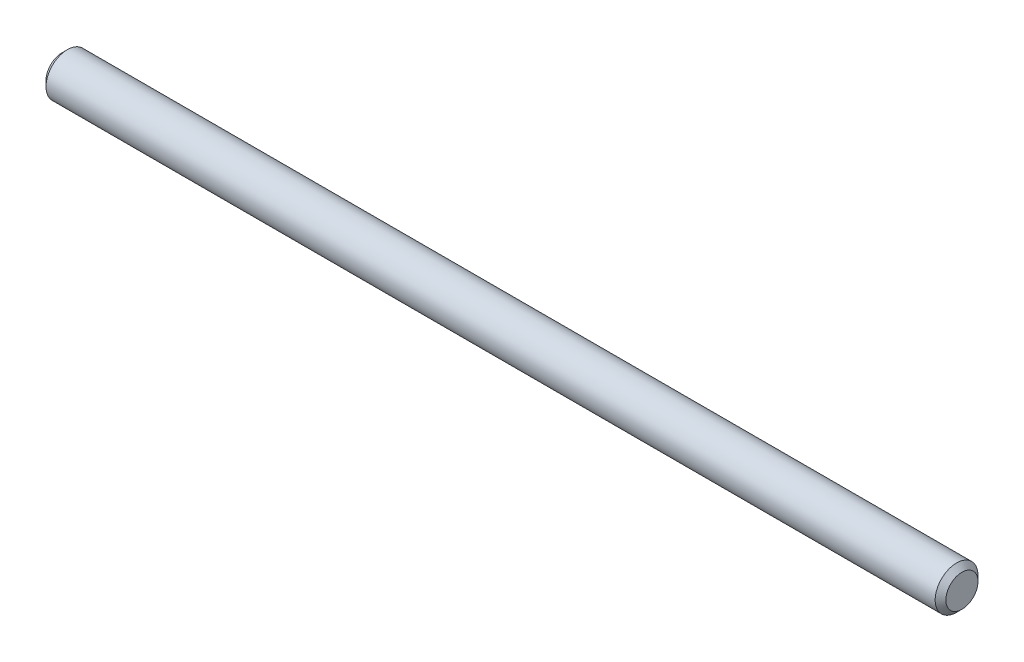
from build123d import *

# Parameters (mm, degrees)
SKETCH1_R           = 2
BOSS_EXTRUDE1_DEPTH = 84
CHAMFER1_SIZE       = 0.5


with BuildPart() as part:
    # Sketch1 → Boss-Extrude1 (new body)
    with BuildSketch(Plane(origin=(0, 0, 0), x_dir=(0, 0, -1), z_dir=(1, 0, 0))):
        Circle(SKETCH1_R)
    extrude(amount=BOSS_EXTRUDE1_DEPTH)

    # Chamfer1
    chamfer1_edges = [part.edges().sort_by_distance(p)[0] for p in [
        (84, 0, 2),
        (0, 0, 2),
    ]]
    chamfer(chamfer1_edges, length=CHAMFER1_SIZE)


solid = part.part
